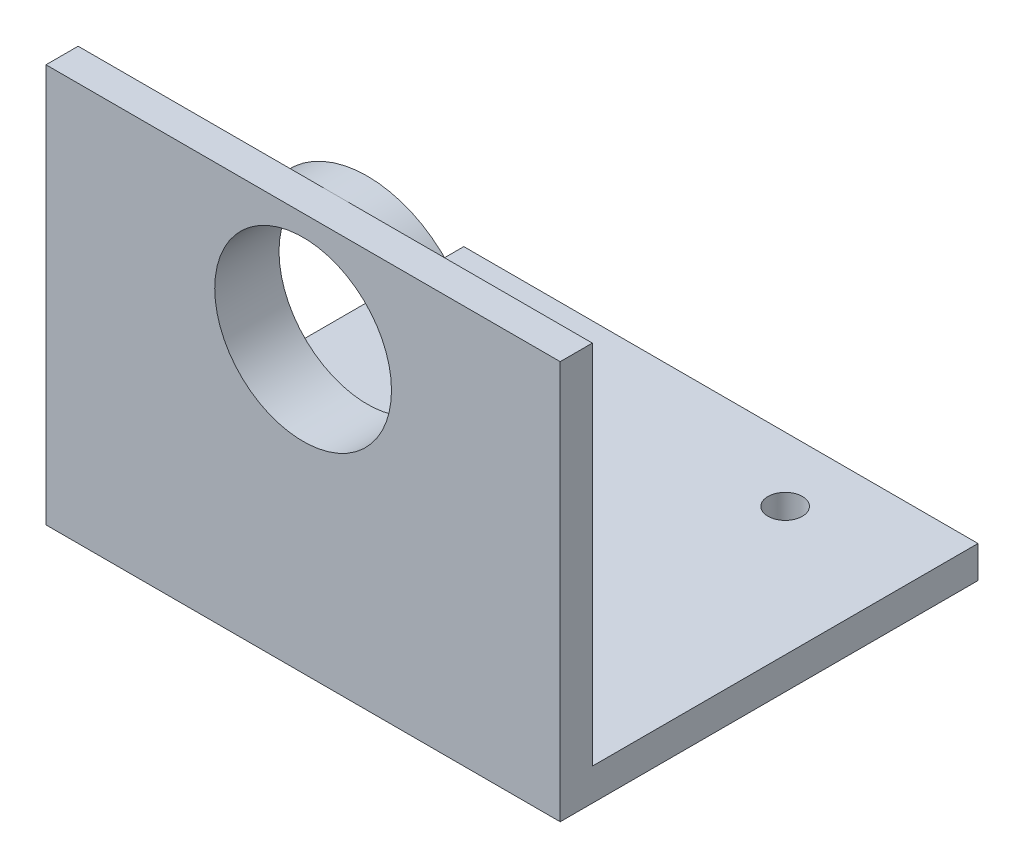
from build123d import *

# Parameters (mm, degrees)
BOSS_EXTRUDE1_DEPTH  = 3.175
M3_CLEARANCE_HOLE1_D = 3.4
SKETCH7_W            = 50.8
SKETCH7_H            = 3.175
BOSS_EXTRUDE3_DEPTH  = 39.37
BOSS_EXTRUDE4_DEPTH  = 3.175
SKETCH9_R            = 8.73125
CUT_EXTRUDE1_DEPTH   = 59.437252887
FILLET1_R            = 3.175


with BuildPart() as part:
    # Sketch2 → Boss-Extrude1 (new body)
    with BuildSketch(Plane(origin=(0, 0, 0), x_dir=(1, 0, 0), z_dir=(0, 1, 0))):
        Polygon((-25.4, -12.7), (25.4, -12.7), (25.4, 12.7), (25.4, 25.4), (-25.4, 25.4), (-25.4, 12.7), align=None)
    extrude(amount=BOSS_EXTRUDE1_DEPTH)

    # M3 Clearance Hole1 (through all)
    with Locations(Plane(origin=(-12.7, 0, -19.05), x_dir=(0, 0, -1), z_dir=(0, -1, 0))):
        with Locations((0, 0), (0, 25.4)):
            Hole(M3_CLEARANCE_HOLE1_D / 2)

    # Sketch7 → Boss-Extrude3 (add)
    with BuildSketch(Plane.XZ):
        with Locations((0, 14.2875)):
            Rectangle(SKETCH7_W, SKETCH7_H)
    extrude(amount=-BOSS_EXTRUDE3_DEPTH)

    # Sketch8 → Boss-Extrude4 (add)
    with BuildSketch(Plane(origin=(0, 0, 12.7), x_dir=(-1, 0, 0), z_dir=(0, 0, -1))):
        with BuildLine():
            Line((-10.795, 28.575), (-10.795, 3.175))
            Line((-10.795, 3.175), (10.795, 3.175))
            Line((10.795, 3.175), (10.795, 28.575))
            ThreePointArc((10.795, 28.575), (0, 39.37), (-10.795, 28.575))
        make_face()
    extrude(amount=BOSS_EXTRUDE4_DEPTH)

    # Sketch9 → Cut-Extrude1 (cut, through all)
    with BuildSketch(Plane(origin=(0, 0, 9.525), x_dir=(-1, 0, 0), z_dir=(0, 0, -1))):
        with Locations((0, 28.575)):
            Circle(SKETCH9_R)
    extrude(amount=-CUT_EXTRUDE1_DEPTH, mode=Mode.SUBTRACT)

    # Fillet1
    fillet1_edges = [part.edges().sort_by_distance(p)[0] for p in [
        (-10.795, 3.175, 11.1125),
        (10.795, 3.175, 11.1125),
    ]]
    fillet(fillet1_edges, radius=FILLET1_R)


solid = part.part
